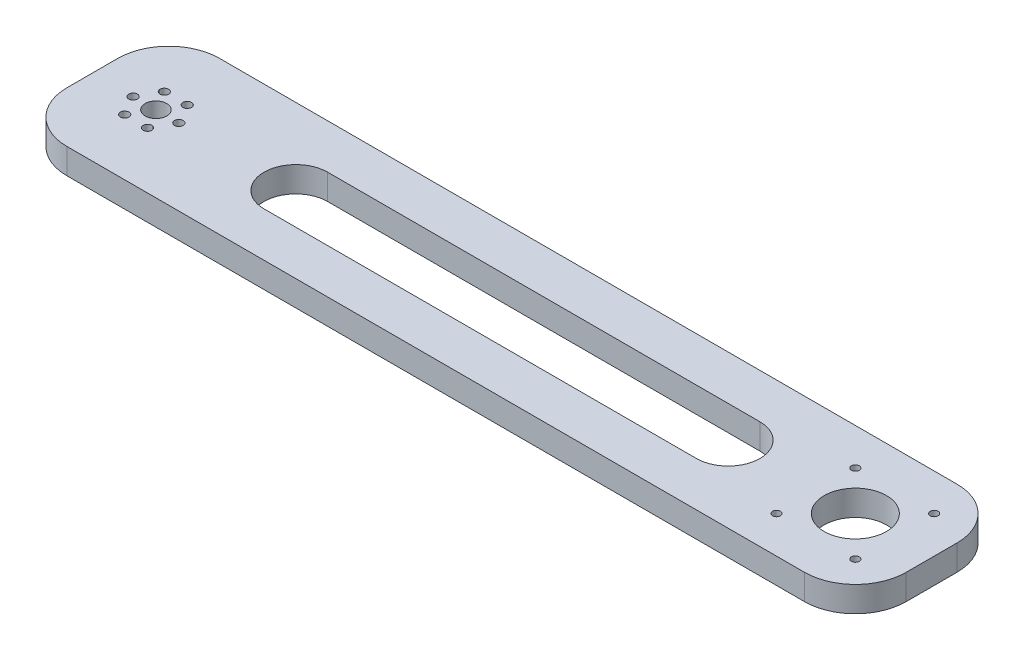
from build123d import *

# Parameters (mm, degrees)
SKETCH_1_W               = 330
SKETCH_1_H               = 60
EXTRUDE_1_DEPTH          = 10
FILLET_1_R               = 20
SKETCH_5_R               = 12.25
CUT_EXTRUDE_3_DEPTH      = 12
SKETCH_9_R               = 1.55
CUT_EXTRUDE_6_DEPTH      = 169.002976164
SKETCH_11_R              = 4.25
CUT_EXTRUDE_8_DEPTH      = 169.002976164
CUT_EXTRUDE_11_DEPTH     = 169.002976164
SKETCH_16_R              = 1.7
CUT_EXTRUDE_12_DEPTH     = 169.002976164
PATTERN_CIRCULAR_1_COUNT = 6


with BuildPart() as part:
    # 草图1 → 凸台-拉伸1 (new body)
    with BuildSketch(Plane(origin=(0, 0, 0), x_dir=(1, 0, 0), z_dir=(0, 1, 0))):
        Rectangle(SKETCH_1_W, SKETCH_1_H)
    extrude(amount=EXTRUDE_1_DEPTH)

    # 圆角1
    fillet_1_edges = [part.edges().sort_by_distance(p)[0] for p in [
        (165, 5, 30),
        (165, 5, -30),
        (-165, 5, -30),
        (-165, 5, 30),
    ]]
    fillet(fillet_1_edges, radius=FILLET_1_R)

    # 草图5 → 切除-拉伸3 (cut)
    with BuildSketch(Plane(origin=(0, 10, 0), x_dir=(1, 0, 0), z_dir=(0, 1, 0))):
        with Locations((135, 0)):
            Circle(SKETCH_5_R)
    extrude(amount=-CUT_EXTRUDE_3_DEPTH, mode=Mode.SUBTRACT)

    # 草图9 → 切除-拉伸6 (cut, through all)
    with BuildSketch(Plane.XZ):
        with Locations((119.5, 15.5)):
            Circle(SKETCH_9_R)
        with Locations((150.5, 15.5)):
            Circle(SKETCH_9_R)
        with Locations((150.5, -15.5)):
            Circle(SKETCH_9_R)
        with Locations((119.5, -15.5)):
            Circle(SKETCH_9_R)
    extrude(amount=-CUT_EXTRUDE_6_DEPTH, mode=Mode.SUBTRACT)

    # 草图11 → 切除-拉伸8 (cut, through all)
    with BuildSketch(Plane.XZ):
        with Locations((-140, 0)):
            Circle(SKETCH_11_R)
    extrude(amount=-CUT_EXTRUDE_8_DEPTH, mode=Mode.SUBTRACT)

    # 草图15 → 切除-拉伸11 (cut, through all)
    with BuildSketch(Plane.XZ):
        with BuildLine():
            Line((-85, 12.5), (85, 12.5))
            ThreePointArc((85, 12.5), (97.5, 0), (85, -12.5))
            Line((85, -12.5), (-85, -12.5))
            ThreePointArc((-85, -12.5), (-97.5, 0), (-85, 12.5))
        make_face()
    extrude(amount=-CUT_EXTRUDE_11_DEPTH, mode=Mode.SUBTRACT)

    # 草图16 → 切除-拉伸12 (cut, through all)
    with BuildSketch(Plane.XZ):
        with Locations((-149, 0)):
            Circle(SKETCH_16_R)
    cut_extrude_12 = extrude(amount=-CUT_EXTRUDE_12_DEPTH, mode=Mode.SUBTRACT)

    # 阵列(圆周)1: 切除-拉伸12 ×6 about axis
    pattern_circular_1_axis = Axis((-140, 0, 0), (0, -1, 0))
    for i in range(1, PATTERN_CIRCULAR_1_COUNT):
        add(cut_extrude_12.rotate(pattern_circular_1_axis, i * 360 / PATTERN_CIRCULAR_1_COUNT), mode=Mode.SUBTRACT)


solid = part.part
